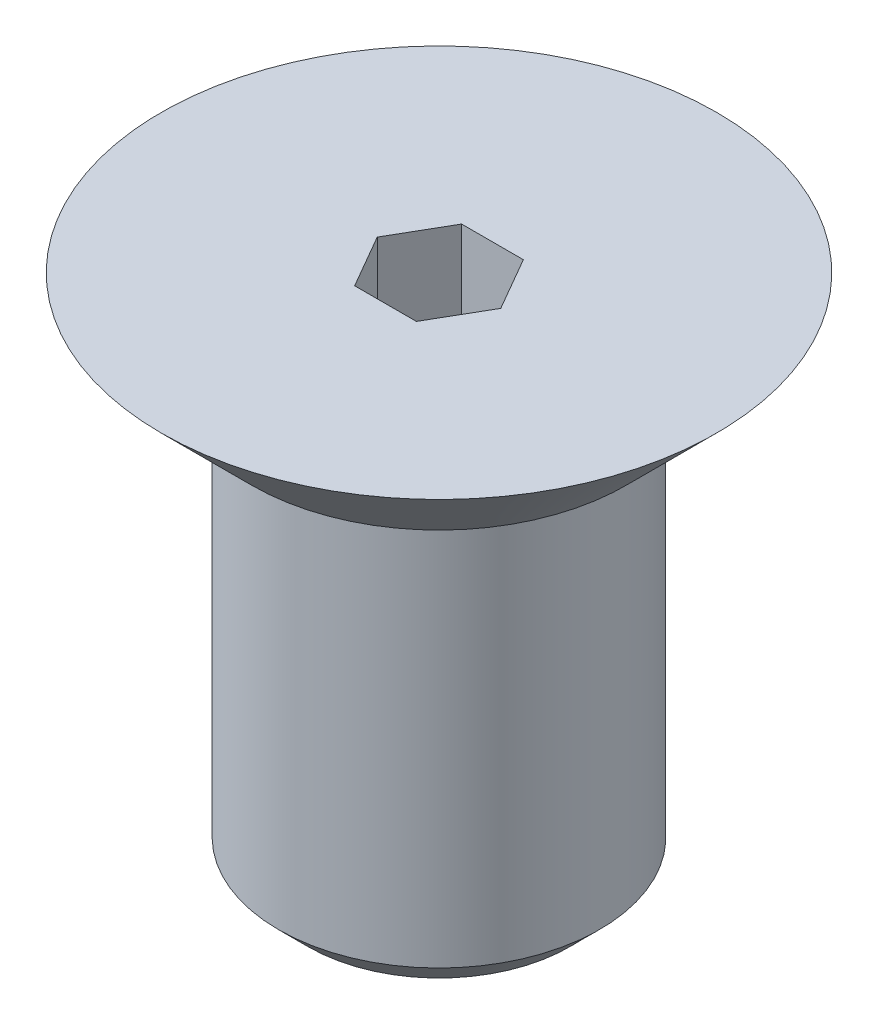
from build123d import *

# Parameters (mm, degrees)
SKETCH1_W          = 3.5
SKETCH1_H          = 8
CUT_EXTRUDE1_DEPTH = 2


# Read off the part's stored shape, not the designer's step: M6x1.0 Machine Threads Stud1
with BuildPart() as part:
    # Sketch1 → Revolve1 (revolve)
    with BuildSketch(Plane.XY, mode=Mode.PRIVATE) as revolve1_sk:
        with Locations((1.75, -5.693638198)):
            Rectangle(SKETCH1_W, SKETCH1_H)
        Polygon((5.193638198, 0), (0, 0), (0, -1.693638198), (3.5, -1.693638198), align=None)
    revolve(revolve1_sk.sketch.rotate(Axis((0, 39.805194805, 0), (0, -1, 0)), 90), axis=Axis((0, 39.805194805, 0), (0, -1, 0)))

    # Sketch2 → Cut-Extrude1 (cut)
    with BuildSketch(Plane(origin=(0, 0, 0), x_dir=(1, 0, 0), z_dir=(0, 1, 0))):
        Polygon((0.577350269, -1), (1.154700538, 0), (0.577350269, 1), (-0.577350269, 1), (-1.154700538, 0), (-0.577350269, -1), align=None)
    extrude(amount=-CUT_EXTRUDE1_DEPTH, mode=Mode.SUBTRACT)

    # M6x1.0 Machine Threads Stud1 outline → M6x1.0 Machine Threads Stud1 (revolve, cut)
    with BuildSketch(Plane.XY):
        Polygon((2.4455, -9.693638198), (3.5, -9.693638198), (3.5, -1.693638198), (3, -1.693638198), (3, -9.139138198), align=None)
    revolve(axis=Axis((0, 0, 0), (0, 1, 0)), mode=Mode.SUBTRACT)


solid = part.part
